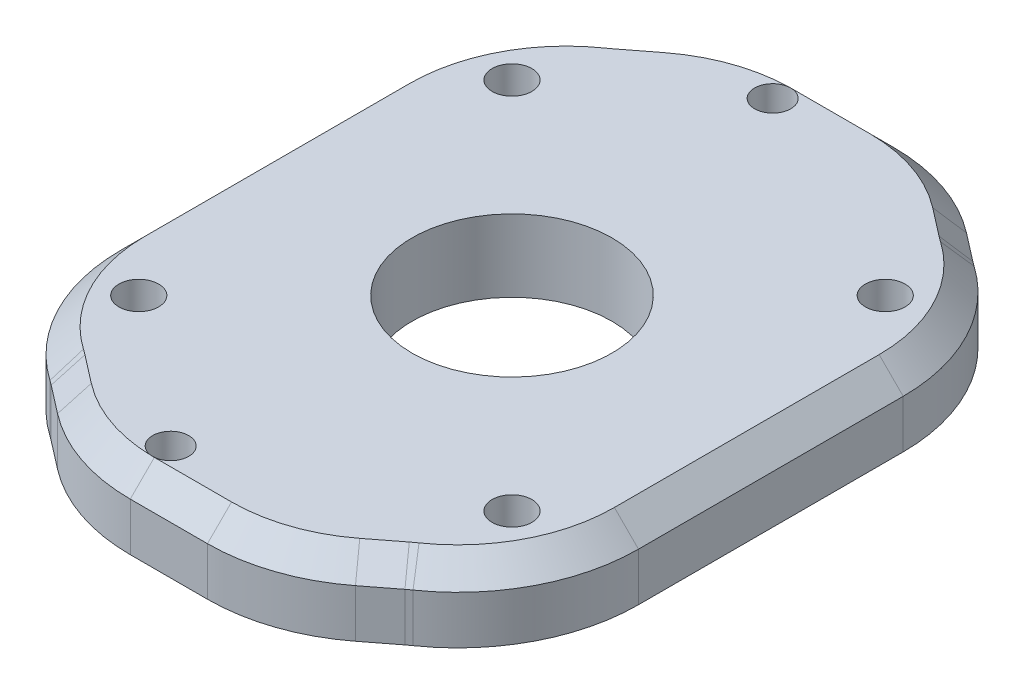
from build123d import *

# Parameters (mm, degrees)
SZKIC1_R                    = 1.65
SZKIC1_R_2                  = 1.5
SZKIC1_R_3                  = 8.3
DODANIE_WYCI_GNI_CIE1_DEPTH = 6
SFAZOWANIE1_SIZE            = 2
SZKIC2_R                    = 1.65
SZKIC2_R_2                  = 1.5
DODANIE_WYCI_GNI_CIE2_DEPTH = 0.2


with BuildPart() as part:
    # Szkic1 → Dodanie-wyciągnięcie1 (new body)
    with BuildSketch(Plane(origin=(0, 0, 0), x_dir=(1, 0, 0), z_dir=(0, 1, 0))):
        with BuildLine():
            Line((-25.903523773, -8.493281025), (-19.491546416, -8.493281025))
            ThreePointArc((-19.491546416, -8.493281025), (-14.649908292, -7.690412435), (-10.326563391, -5.367753061))
            Line((-10.326563391, -5.367753061), (-8.006357575, -3.576966334))
            ThreePointArc((-8.006357575, -3.576966334), (-7.813323472, -3.431665275), (-7.616835373, -3.29107015))
            ThreePointArc((-7.616835373, -3.29107015), (-2.898841628, 2.073604214), (-1.197535095, 9.012246163))
            Line((-1.197535095, 9.012246163), (-1.197535095, 31.001191788))
            ThreePointArc((-1.197535095, 31.001191788), (-2.898841628, 37.939833736), (-7.616835373, 43.3045081))
            ThreePointArc((-7.616835373, 43.3045081), (-7.813323472, 43.445103226), (-8.006357575, 43.590404284))
            Line((-8.006357575, 43.590404284), (-10.326563391, 45.381191012))
            ThreePointArc((-10.326563391, 45.381191012), (-14.649908292, 47.703850385), (-19.491546416, 48.506718975))
            Line((-19.491546416, 48.506718975), (-25.903523773, 48.506718975))
            ThreePointArc((-25.903523773, 48.506718975), (-30.745161897, 47.703850385), (-35.068506799, 45.381191012))
            Line((-35.068506799, 45.381191012), (-37.388712614, 43.590404284))
            ThreePointArc((-37.388712614, 43.590404284), (-37.581746717, 43.445103226), (-37.778234817, 43.3045081))
            ThreePointArc((-37.778234817, 43.3045081), (-42.496228561, 37.939833736), (-44.197535095, 31.001191788))
            Line((-44.197535095, 31.001191788), (-44.197535095, 9.012246163))
            ThreePointArc((-44.197535095, 9.012246163), (-42.496228561, 2.073604214), (-37.778234817, -3.29107015))
            ThreePointArc((-37.778234817, -3.29107015), (-37.581746717, -3.431665275), (-37.388712614, -3.576966334))
            Line((-37.388712614, -3.576966334), (-35.068506799, -5.367753061))
            ThreePointArc((-35.068506799, -5.367753061), (-30.745161897, -7.690412435), (-25.903523773, -8.493281025))
        make_face()
        with Locations(Location((-38.197535095, 35.506718975, 0), (0, 0, 270))):
            Circle(SZKIC1_R, mode=Mode.SUBTRACT)
        with Locations(Location((-26.047535095, 45.006718975, 0), (0, 0, 270))):
            Circle(SZKIC1_R_2, mode=Mode.SUBTRACT)
        with Locations(Location((-7.197535095, 35.506718975, 0), (0, 0, 270))):
            Circle(SZKIC1_R, mode=Mode.SUBTRACT)
        with Locations(Location((-38.197535095, 4.506718975, 0), (0, 0, 270))):
            Circle(SZKIC1_R, mode=Mode.SUBTRACT)
        with Locations(Location((-26.047535095, -4.993281025, 0), (0, 0, 270))):
            Circle(SZKIC1_R_2, mode=Mode.SUBTRACT)
        with Locations(Location((-7.197535095, 4.506718975, 0), (0, 0, 270))):
            Circle(SZKIC1_R, mode=Mode.SUBTRACT)
        with Locations(Location((-22.697535095, 20.006718975, 0), (0, 0, 270))):
            Circle(SZKIC1_R_3, mode=Mode.SUBTRACT)
    extrude(amount=DODANIE_WYCI_GNI_CIE1_DEPTH)

    # Sfazowanie1
    # the kernel refuses this chamfer: 2 mm, written as the material it takes off along each edge
    with BuildSketch(Plane(origin=(-19.491546416, 6, -33.506718975), x_dir=(0.6109988683682814, 0, -0.791631469089424), z_dir=(0.791631469089424, 0, 0.6109988683682814))) as sfazowanie1_piece_1:
        Polygon((15, -SFAZOWANIE1_SIZE), (15 - SFAZOWANIE1_SIZE, 0), (15, 0), align=None)
    revolve(axis=Axis((-19.491546416, 6, -33.506718975), (0, 1, 0)), revolution_arc=37.661762745, mode=Mode.SUBTRACT)
    with BuildSketch(Plane(origin=(-19.491546416, 6, -48.506718975), x_dir=(0, -0.9996219169112968, -0.02749587661058563), z_dir=(-1, 0, 0)), Plane(origin=(-25.903523773, 6, 8.493281025), x_dir=(0, -0.9996219169112968, 0.027495876610586487), z_dir=(1, 0, 0))) as sfazowanie1_piece_2:
        Polygon((SFAZOWANIE1_SIZE * 0.999621916911, SFAZOWANIE1_SIZE * 0.0274958766106), (-SFAZOWANIE1_SIZE * 0.0274958766106, SFAZOWANIE1_SIZE * 0.999621916911), (0, 0), align=None)
    extrude(amount=6.411977357, mode=Mode.SUBTRACT)
    with BuildSketch(Plane(origin=(-25.903523773, 6, -33.506718975), x_dir=(0, 0, -1), z_dir=(1, 0, 0))) as sfazowanie1_piece_3:
        Polygon((15, -SFAZOWANIE1_SIZE), (15 - SFAZOWANIE1_SIZE, 0), (15, 0), align=None)
    revolve(axis=Axis((-25.903523773, 6, -33.506718975), (0, 1, 0)), revolution_arc=37.661762745, mode=Mode.SUBTRACT)
    with BuildSketch(Plane(origin=(-35.068506799, 6, -45.381191012), x_dir=(-0.01679994949386156, -0.9996219169112968, -0.021766601195139172), z_dir=(-0.7916314690894233, 0, 0.6109988683682824)), Plane(origin=(-37.388712614, 6, 3.576966334), x_dir=(-0.01679994949386157, -0.9996219169112968, 0.02176660119513917), z_dir=(0.791631469089423, 0, 0.6109988683682828)), Plane(origin=(-10.326563391, 6, 5.367753061), x_dir=(0.016799949493862203, -0.9996219169112968, 0.021766601195140015), z_dir=(0.7916314690894233, 0, -0.6109988683682822)), Plane(origin=(-8.006357575, 6, -43.590404284), x_dir=(0.01679994949386218, -0.9996219169112968, -0.02176660119514003), z_dir=(-0.791631469089424, 0, -0.6109988683682814))) as sfazowanie1_piece_4:
        Polygon((SFAZOWANIE1_SIZE * 0.999621916911, SFAZOWANIE1_SIZE * 0.0274958766106), (-SFAZOWANIE1_SIZE * 0.0274958766106, SFAZOWANIE1_SIZE * 0.999621916911), (0, 0), align=None)
    extrude(amount=2.930916602, mode=Mode.SUBTRACT)
    with BuildSketch(Plane(origin=(-43.498701298, 6, -51.506718975), x_dir=(0.6109988683682784, 0, 0.7916314690894262), z_dir=(0.7916314690894262, 0, -0.6109988683682784))) as sfazowanie1_piece_5:
        Polygon((10, SFAZOWANIE1_SIZE), (10 + SFAZOWANIE1_SIZE, 0), (10, 0), align=None)
    revolve(axis=Axis((-43.498701298, 6, -51.506718975), (0, -1, 0)), revolution_arc=2.76869433, mode=Mode.SUBTRACT)
    with BuildSketch(Plane(origin=(-29.197535095, 6, -31.001191788), x_dir=(-0.5720466481227963, 0, -0.820221087494996), z_dir=(0.820221087494996, 0, -0.5720466481227963))) as sfazowanie1_piece_6:
        Polygon((15, -SFAZOWANIE1_SIZE), (15 - SFAZOWANIE1_SIZE, 0), (15, 0), align=None)
    revolve(axis=Axis((-29.197535095, 6, -31.001191788), (0, 1, 0)), revolution_arc=55.106931585, mode=Mode.SUBTRACT)
    with BuildSketch(Plane(origin=(-44.197535095, 6, -31.001191788), x_dir=(-0.02749587661058563, -0.9996219169112968, 0), z_dir=(0, 0, 1)), Plane(origin=(-1.197535095, 6, -9.012246163), x_dir=(0.027495876610586382, -0.9996219169112968, 0), z_dir=(0, 0, -1))) as sfazowanie1_piece_7:
        Polygon((SFAZOWANIE1_SIZE * 0.999621916911, SFAZOWANIE1_SIZE * 0.0274958766106), (-SFAZOWANIE1_SIZE * 0.0274958766106, SFAZOWANIE1_SIZE * 0.999621916911), (0, 0), align=None)
    extrude(amount=21.988945625, mode=Mode.SUBTRACT)
    with BuildSketch(Plane(origin=(-29.197535095, 6, -9.012246163), x_dir=(-1, 0, 0), z_dir=(0, 0, -1))) as sfazowanie1_piece_8:
        Polygon((15, -SFAZOWANIE1_SIZE), (15 - SFAZOWANIE1_SIZE, 0), (15, 0), align=None)
    revolve(axis=Axis((-29.197535095, 6, -9.012246163), (0, 1, 0)), revolution_arc=55.106931585, mode=Mode.SUBTRACT)
    with BuildSketch(Plane(origin=(-43.498701298, 6, 11.493281025), x_dir=(0.5720466481228126, 0, -0.8202210874949846), z_dir=(-0.8202210874949846, 0, -0.5720466481228126))) as sfazowanie1_piece_9:
        Polygon((10, SFAZOWANIE1_SIZE), (10 + SFAZOWANIE1_SIZE, 0), (10, 0), align=None)
    revolve(axis=Axis((-43.498701298, 6, 11.493281025), (0, -1, 0)), revolution_arc=2.76869433, mode=Mode.SUBTRACT)
    with BuildSketch(Plane(origin=(-25.903523773, 6, -6.506718975), x_dir=(-0.6109988683682754, 0, 0.7916314690894285), z_dir=(-0.7916314690894285, 0, -0.6109988683682754))) as sfazowanie1_piece_10:
        Polygon((15, -SFAZOWANIE1_SIZE), (15 - SFAZOWANIE1_SIZE, 0), (15, 0), align=None)
    revolve(axis=Axis((-25.903523773, 6, -6.506718975), (0, 1, 0)), revolution_arc=37.661762745, mode=Mode.SUBTRACT)
    with BuildSketch(Plane(origin=(-19.491546416, 6, -6.506718975), x_dir=(0, 0, 1), z_dir=(-1, 0, 0))) as sfazowanie1_piece_11:
        Polygon((15, -SFAZOWANIE1_SIZE), (15 - SFAZOWANIE1_SIZE, 0), (15, 0), align=None)
    revolve(axis=Axis((-19.491546416, 6, -6.506718975), (0, 1, 0)), revolution_arc=37.661762745, mode=Mode.SUBTRACT)
    with BuildSketch(Plane(origin=(-1.896368892, 6, 11.493281025), x_dir=(-0.61099886836827, 0, -0.7916314690894327), z_dir=(-0.7916314690894327, 0, 0.61099886836827))) as sfazowanie1_piece_12:
        Polygon((10, SFAZOWANIE1_SIZE), (10 + SFAZOWANIE1_SIZE, 0), (10, 0), align=None)
    revolve(axis=Axis((-1.896368892, 6, 11.493281025), (0, -1, 0)), revolution_arc=2.76869433, mode=Mode.SUBTRACT)
    with BuildSketch(Plane(origin=(-16.197535095, 6, -9.012246163), x_dir=(0.5720466481227972, 0, 0.8202210874949952), z_dir=(-0.8202210874949952, 0, 0.5720466481227972))) as sfazowanie1_piece_13:
        Polygon((15, -SFAZOWANIE1_SIZE), (15 - SFAZOWANIE1_SIZE, 0), (15, 0), align=None)
    revolve(axis=Axis((-16.197535095, 6, -9.012246163), (0, 1, 0)), revolution_arc=55.106931585, mode=Mode.SUBTRACT)
    with BuildSketch(Plane(origin=(-16.197535095, 6, -31.001191788), x_dir=(1, 0, 0), z_dir=(0, 0, 1))) as sfazowanie1_piece_14:
        Polygon((15, -SFAZOWANIE1_SIZE), (15 - SFAZOWANIE1_SIZE, 0), (15, 0), align=None)
    revolve(axis=Axis((-16.197535095, 6, -31.001191788), (0, 1, 0)), revolution_arc=55.106931585, mode=Mode.SUBTRACT)
    with BuildSketch(Plane(origin=(-1.896368892, 6, -51.506718975), x_dir=(-0.5720466481227885, 0, 0.8202210874950013), z_dir=(0.8202210874950013, 0, 0.5720466481227885))) as sfazowanie1_piece_15:
        Polygon((10, SFAZOWANIE1_SIZE), (10 + SFAZOWANIE1_SIZE, 0), (10, 0), align=None)
    revolve(axis=Axis((-1.896368892, 6, -51.506718975), (0, -1, 0)), revolution_arc=2.76869433, mode=Mode.SUBTRACT)

    # Szkic2 → Dodanie-wyciągnięcie2 (add)
    with BuildSketch(Plane.XZ):
        with Locations(Location((-38.197535095, -35.506718975, 0), (0, 0, 270))):
            Circle(SZKIC2_R)
        with Locations(Location((-26.047535095, -45.006718975, 0), (0, 0, 270))):
            Circle(SZKIC2_R_2)
        with Locations(Location((-7.197535095, -35.506718975, 0), (0, 0, 270))):
            Circle(SZKIC2_R)
        with Locations(Location((-7.197535095, -4.506718975, 0), (0, 0, 270))):
            Circle(SZKIC2_R)
        with Locations(Location((-38.197535095, -4.506718975, 0), (0, 0, 270))):
            Circle(SZKIC2_R)
        with Locations(Location((-26.047535095, 4.993281025, 0), (0, 0, 270))):
            Circle(SZKIC2_R_2)
    extrude(amount=-DODANIE_WYCI_GNI_CIE2_DEPTH)


solid = part.part
